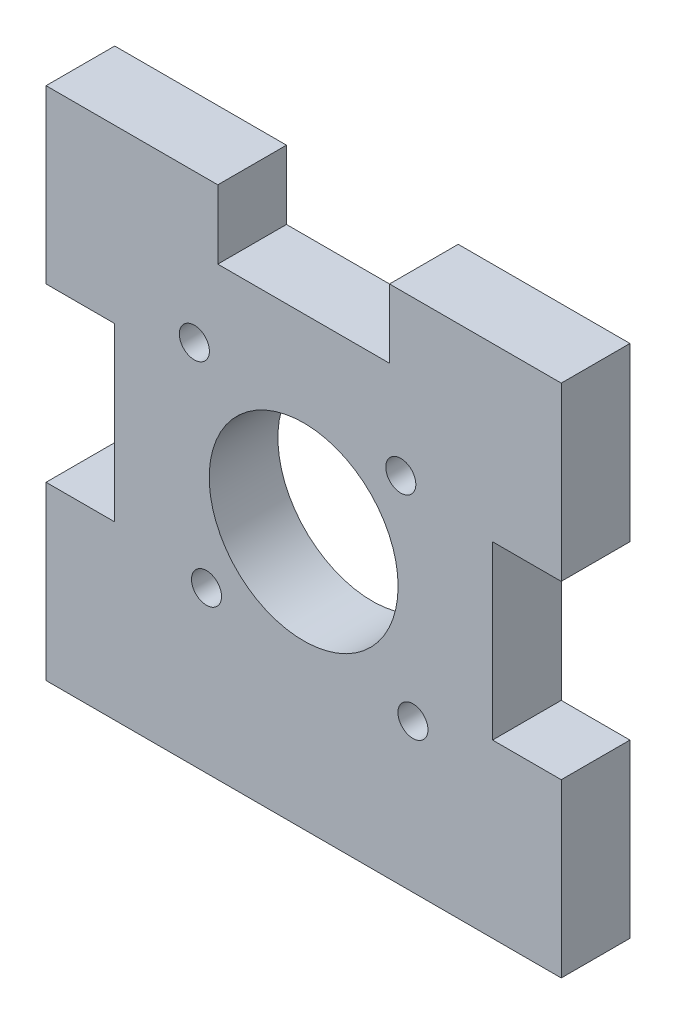
from build123d import *

# Parameters (mm, degrees)
SKIZZE1_W                       = 30
SKIZZE1_H                       = 30
AUFSATZ_LINEAR_AUSTRAGEN1_DEPTH = 4
SKIZZE2_R                       = 5.5
SKIZZE2_R_2                     = 0.875
SCHNITT_LINEAR_AUSTRAGEN1_DEPTH = 4
SKIZZE3_W                       = 4
SKIZZE3_H                       = 10
SKIZZE3_W_2                     = 10
SKIZZE3_H_2                     = 4
SCHNITT_LINEAR_AUSTRAGEN2_DEPTH = 22.587033145


with BuildPart() as part:
    # Skizze1 → Aufsatz-Linear austragen1 (new body)
    with BuildSketch(Plane.XY):
        Rectangle(SKIZZE1_W, SKIZZE1_H)
    extrude(amount=AUFSATZ_LINEAR_AUSTRAGEN1_DEPTH)

    # Skizze2 → Schnitt-Linear austragen1 (cut)
    with BuildSketch(Plane.XY.offset(4)):
        Circle(SKIZZE2_R)
        with Locations((5.656854249, 5.656854249)):
            Circle(SKIZZE2_R_2)
        with Locations((6.363961031, -6.363961031)):
            Circle(SKIZZE2_R_2)
        with Locations((-5.656854249, -5.656854249)):
            Circle(SKIZZE2_R_2)
        with Locations((-6.363961031, 6.363961031)):
            Circle(SKIZZE2_R_2)
    extrude(amount=-SCHNITT_LINEAR_AUSTRAGEN1_DEPTH, mode=Mode.SUBTRACT)

    # Skizze3 → Schnitt-Linear austragen2 (cut, through all)
    with BuildSketch(Plane.XY.offset(4)):
        with Locations((-13, 0)):
            Rectangle(SKIZZE3_W, SKIZZE3_H)
        with Locations((0, 13)):
            Rectangle(SKIZZE3_W_2, SKIZZE3_H_2)
        with Locations((13, 0)):
            Rectangle(SKIZZE3_W, SKIZZE3_H)
    extrude(amount=-SCHNITT_LINEAR_AUSTRAGEN2_DEPTH, mode=Mode.SUBTRACT)


solid = part.part
